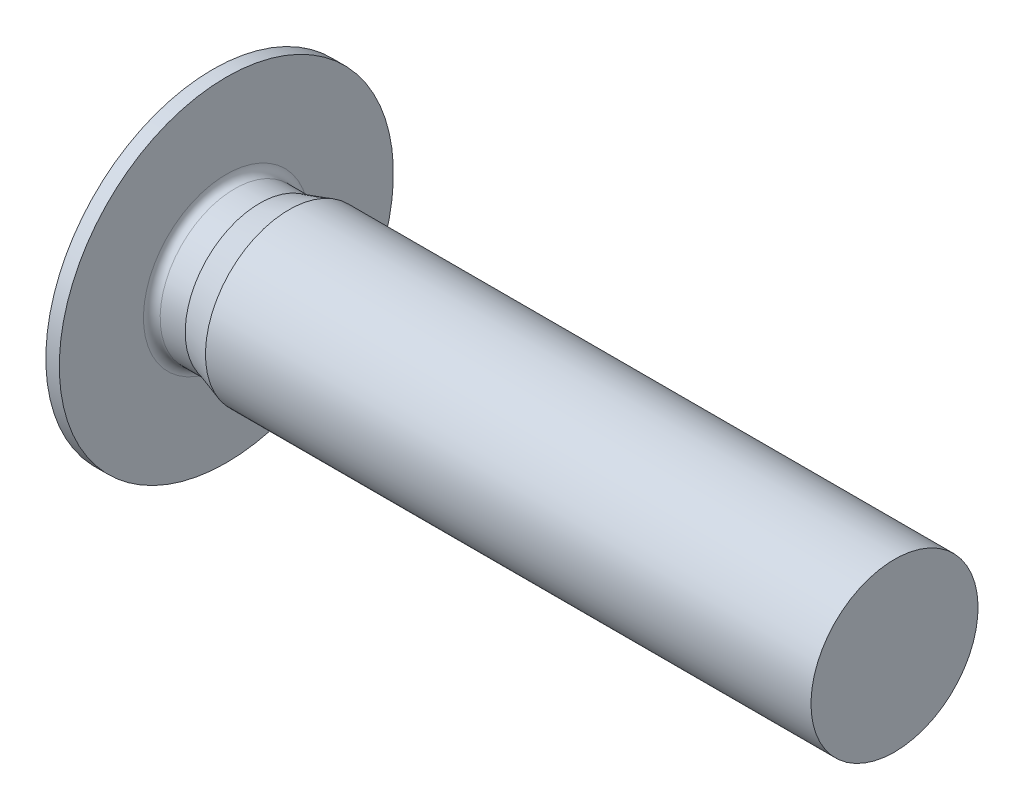
from build123d import *

# Parameters (mm, degrees)
FILLET1_R          = 0.2
CUT_EXTRUDE1_DEPTH = 2.5


with BuildPart() as part:
    # Sketch1 → Revolve1 (revolve)
    with BuildSketch(Plane.XY):
        Polygon((-0.9, 0), (-0.9, 3), (-0.322649731, 4), (0, 4), (0, 1.785), (0.8, 1.785), (1.5, 2), (16, 2), (16, 0), align=None)
    revolve(axis=Axis((-0.9, 0, 0), (1, 0, 0)))

    # Fillet1
    fillet1_edges = [part.edges().sort_by_distance(p)[0] for p in [
        (0, -1.785, 0),
    ]]
    fillet(fillet1_edges, radius=FILLET1_R)

    # Sketch2 → Cut-Extrude1 (cut)
    with BuildSketch(Plane.ZY.offset(0.9)):
        Polygon((0, 1.154700538), (-1, 0.577350269), (-1, -0.577350269), (0, -1.154700538), (1, -0.577350269), (1, 0.577350269), align=None)
    extrude(amount=-CUT_EXTRUDE1_DEPTH, mode=Mode.SUBTRACT)

    # Sketch3 → Cut-Revolve1 (revolve, cut)
    with BuildSketch(Plane.XY):
        Polygon((1.6, 0), (1.6, 1), (2.200860619, 0), align=None)
    revolve(axis=Axis((1.6, 0, 0), (1, 0, 0)), mode=Mode.SUBTRACT)


solid = part.part
